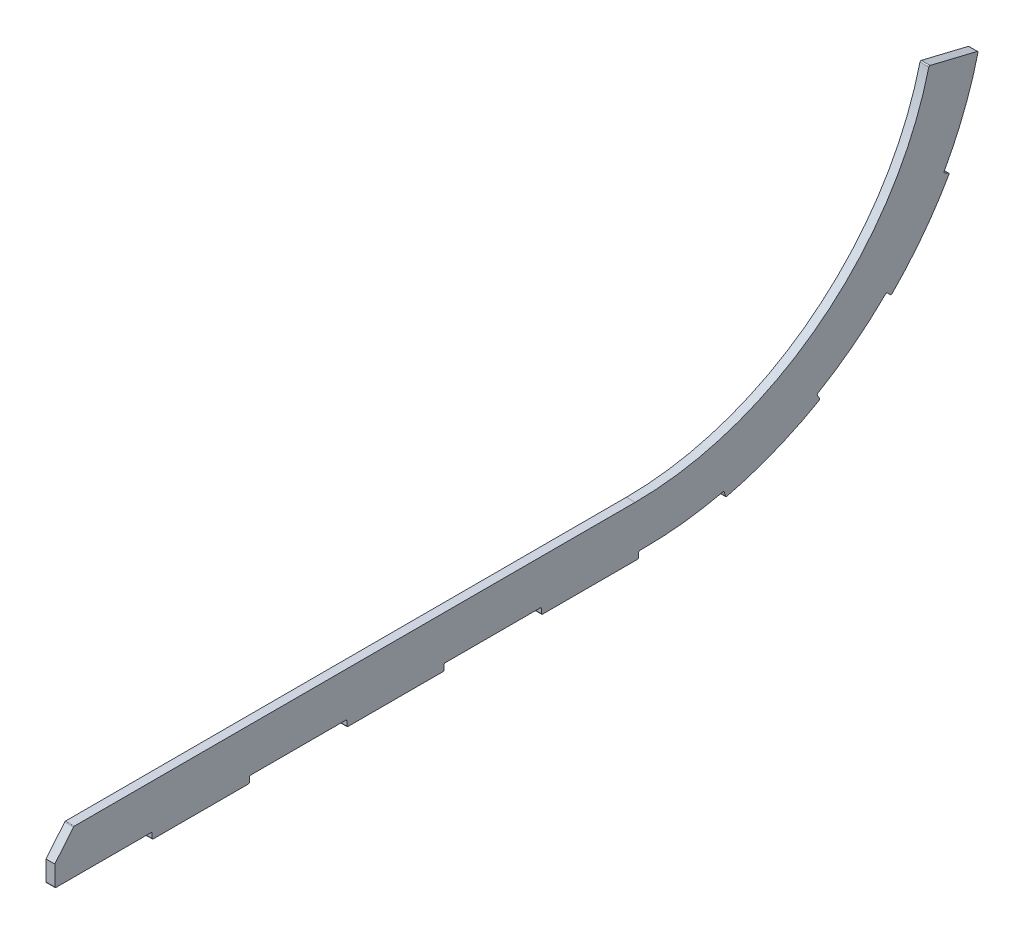
from build123d import *

# Parameters (mm, degrees)
BASE_FLANGE1_DEPTH = 8
FILLET_1_0_R       = 1


# Sheet-metal steps are written as plain solids
with BuildPart() as part:
    # Sketch1 → Base-Flange1 (new body)
    with BuildSketch(Plane(origin=(0, 0, 0), x_dir=(0, 0, -1), z_dir=(1, 0, 0))):
        with BuildLine():
            Line((531, -15), (442.5, -15))
            Line((442.5, -15), (442.5, -9))
            Line((442.5, -9), (354, -9))
            Line((354, -9), (354, -15))
            Line((354, -15), (265.5, -15))
            Line((265.5, -15), (265.5, -9))
            Line((265.5, -9), (177, -9))
            Line((177, -9), (177, -15))
            Line((177, -15), (88.5, -15))
            Line((88.5, -15), (88.5, -9))
            Line((88.5, -9), (0, -9))
            Line((0, -9), (0, 10))
            Line((0, 10), (17.311064102, 31))
            Line((17.311064102, 31), (527.748052756, 31))
            ThreePointArc((527.748052756, 31), (697.748052756, 89.840336788), (795, 241.181818182))
            Line((795, 241.181818182), (839.703962084, 230.339504132))
            ThreePointArc((839.703962084, 230.339504132), (826.746837948, 189.2327939), (808.257153356, 150.299771211))
            Line((808.257153356, 150.299771211), (813.503193561, 147.387888287))
            ThreePointArc((813.503193561, 147.387888287), (789.433768579, 110.742928998), (760.560188707, 77.750404912))
            Line((760.560188707, 77.750404912), (756.275511236, 81.951113323))
            ThreePointArc((756.275511236, 81.951113323), (726.159050553, 55.606079515), (692.923211747, 33.325122864))
            Line((692.923211747, 33.325122864), (695.938293543, 28.137816444))
            ThreePointArc((695.938293543, 28.137816444), (654.250802879, 7.812798402), (610.053579846, -6.242759659))
            Line((610.053579846, -6.242759659), (608.523872748, -0.439504608))
            ThreePointArc((608.523872748, -0.439504608), (572.452930854, -6.852497602), (535.879339812, -9))
            Line((535.879339812, -9), (531, -9))
            Line((531, -9), (531, -15))
        make_face()
    extrude(amount=-BASE_FLANGE1_DEPTH)

    # Fillet-1.0
    fillet_1_0_edges = [part.edges().sort_by_distance(p)[0] for p in [
        (-4, 31, -17.311064102),
        (-4, 241.181818182, -795),
        (-4, 230.339504132, -839.703962084),
        (-4, 150.299771211, -808.257153356),
        (-4, 147.387888287, -813.503193561),
        (-4, 77.750404912, -760.560188707),
        (-4, 81.951113323, -756.275511236),
        (-4, 33.325122864, -692.923211747),
        (-4, 28.137816444, -695.938293543),
        (-4, -6.242759659, -610.053579846),
        (-4, -0.439504608, -608.523872748),
        (-4, -9, -531),
        (-4, -15, -531),
        (-4, -15, -442.5),
        (-4, -9, -442.5),
        (-4, -9, -354),
        (-4, -15, -354),
        (-4, -15, -265.5),
        (-4, -9, -265.5),
        (-4, -9, -177),
        (-4, -15, -177),
        (-4, -15, -88.5),
        (-4, -9, -88.5),
        (-4, -9, 0),
    ]]
    fillet(fillet_1_0_edges, radius=FILLET_1_0_R)


solid = part.part
